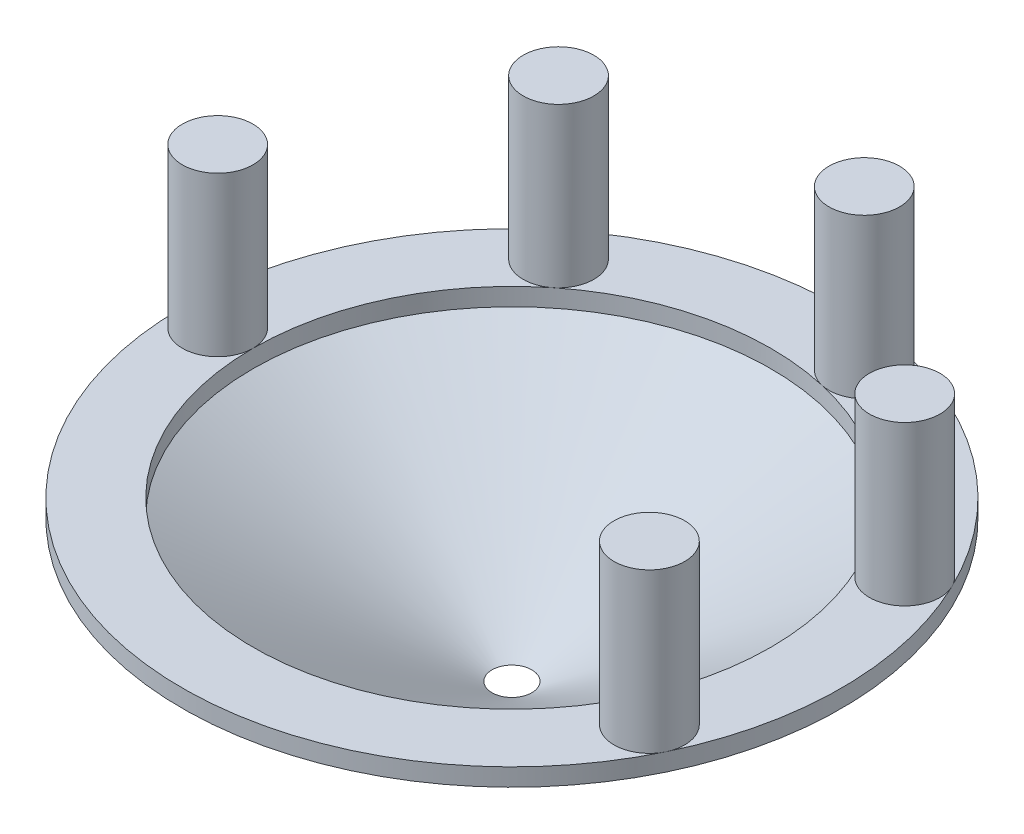
from build123d import *

# Parameters (mm, degrees)
SKETCH3_R           = 3
BOSS_EXTRUDE1_DEPTH = 15
CIRPATTERN1_COUNT   = 5
CIRPATTERN1_ANGLE   = 205.714285714


with BuildPart() as part:
    # Sketch1 → Revolve1 (revolve)
    with BuildSketch(Plane.XY):
        Polygon((28, 0), (3.175, -12), (1.68595, -12), (22, 0), (22, 1.5), (28, 1.5), align=None)
    revolve(axis=Axis((0, -582.446756226, 0), (0, 1, 0)))

    # Sketch3 → Boss-Extrude1 (add)
    with BuildSketch(Plane(origin=(0, 0, 0), x_dir=(1, 0, 0), z_dir=(0, 1, 0))):
        with Locations((-25, 0)):
            Circle(SKETCH3_R)
    boss_extrude1 = extrude(amount=BOSS_EXTRUDE1_DEPTH)

    # CirPattern1: Boss-Extrude1 ×5 about axis
    cirpattern1_axis = Axis((0, 0, 0), (0, -1, 0))
    for i in range(1, CIRPATTERN1_COUNT):
        add(boss_extrude1.rotate(cirpattern1_axis, i * CIRPATTERN1_ANGLE / (CIRPATTERN1_COUNT - 1)))


solid = part.part
